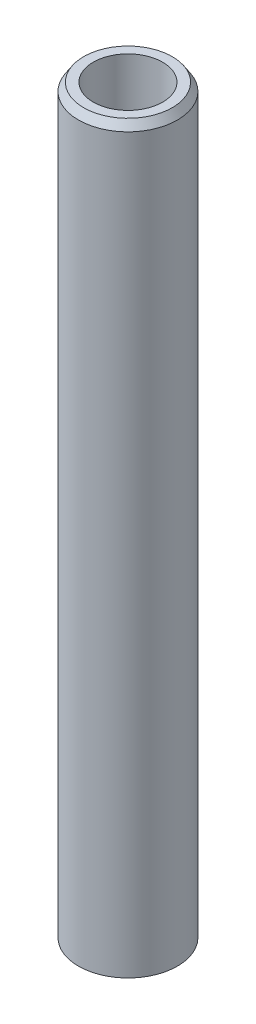
from build123d import *
from OCP.BRepFilletAPI import BRepFilletAPI_MakeChamfer

# Parameters (mm, degrees)
SKETCH1_R           = 25
BOSS_EXTRUDE1_DEPTH = 376.888596724
SKETCH2_R           = 17.517155992
CUT_EXTRUDE1_DEPTH  = 379.543279349
CHAMFER1_SIZE       = 4.071959372
CHAMFER1_SIZE2      = 2.630925926


with BuildPart() as part:
    # Sketch1 → Boss-Extrude1 (new body)
    with BuildSketch(Plane(origin=(0, 0, 0), x_dir=(1, 0, 0), z_dir=(0, 1, 0))):
        Circle(SKETCH1_R)
    extrude(amount=BOSS_EXTRUDE1_DEPTH)

    # Sketch2 → Cut-Extrude1 (cut, through all)
    with BuildSketch(Plane(origin=(0, 0, 0), x_dir=(1, 0, 0), z_dir=(0, 1, 0))):
        Circle(SKETCH2_R)
    extrude(amount=CUT_EXTRUDE1_DEPTH, mode=Mode.SUBTRACT)

    # Chamfer1: one chamfer whose edges measure the first distance from different faces: ONE call of the kernel's chamfer builder (chamfer() names one face for all edges)
    chamfer1_edges_1 = [part.edges().sort_by_distance(p)[0] for p in [
        (-25, 376.888596724, 0),
    ]]
    chamfer1_side_1 = [part.faces().sort_by_distance(p)[0] for p in [
        (-25, 188.444298362, 0),
    ]]
    chamfer1_edges_2 = [part.edges().sort_by_distance(p)[0] for p in [
        (-25, 0, 0),
    ]]
    chamfer1_side_2 = [part.faces().sort_by_distance(p)[0] for p in [
        (-24.292893219, 0, 0),
    ]]
    chamfer1 = BRepFilletAPI_MakeChamfer(part.part.solid().wrapped)
    for e in chamfer1_edges_1:
        chamfer1.Add(CHAMFER1_SIZE, CHAMFER1_SIZE2, e.wrapped, chamfer1_side_1[0].wrapped)  # the first distance lies on this face
    for e in chamfer1_edges_2:
        chamfer1.Add(CHAMFER1_SIZE, CHAMFER1_SIZE2, e.wrapped, chamfer1_side_2[0].wrapped)  # the first distance lies on this face
    add(Compound.cast(chamfer1.Shape()), mode=Mode.REPLACE)


solid = part.part
